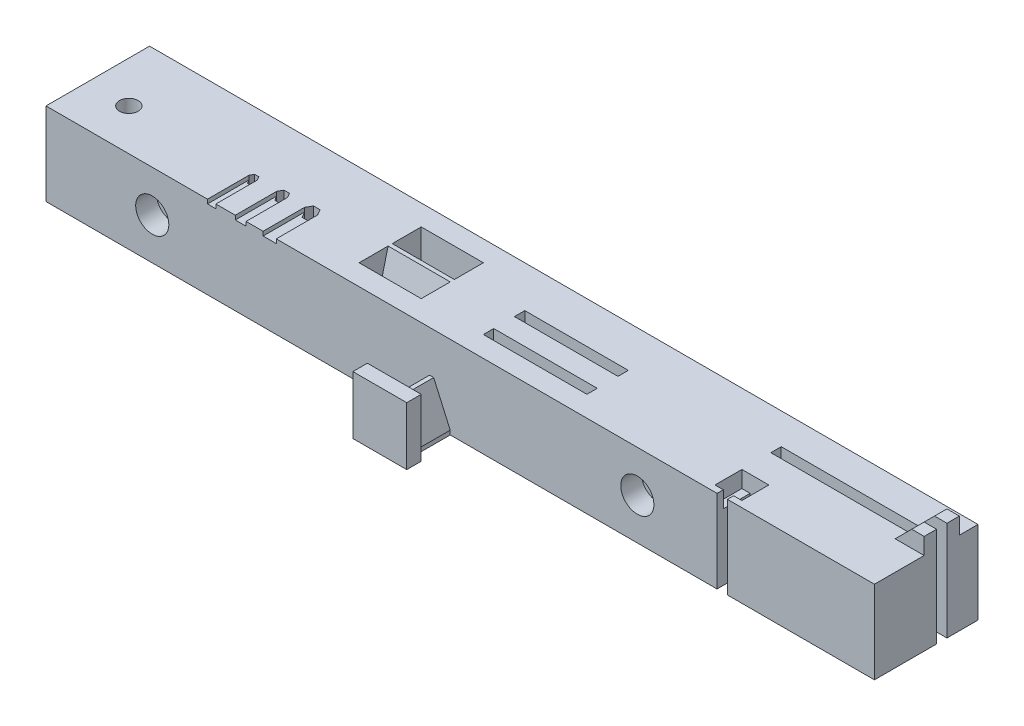
from build123d import *

# Parameters (mm, degrees)
SCHIZZO1_W                    = 200
SCHIZZO1_H                    = 20
ESTRUSIONE_ESTRUSIONE1_DEPTH  = 25
SCHIZZO2_R                    = 2.25
TAGLIO_ESTRUSIONE1_DEPTH      = 141.400046302
SCHIZZO4_W                    = 2.020725942
SCHIZZO4_H                    = 10
SCHIZZO4_W_2                  = 2.598076211
SCHIZZO4_W_3                  = 3.175426481
TAGLIO_ESTRUSIONE2_DEPTH      = 1
SCHIZZO7_W                    = 15
SCHIZZO7_H                    = 5.5
TAGLIO_ESTRUSIONE3_DEPTH      = 141.400046302
SMUSSO1_SIZE                  = 1.5
SMUSSO1_SIZE2                 = 6
SCHIZZO8_W                    = 25
SCHIZZO8_H                    = 2.5
TAGLIO_ESTRUSIONE4_DEPTH      = 13
SCHIZZO9_W                    = 40
SCHIZZO9_H                    = 2.5
TAGLIO_ESTRUSIONE5_DEPTH      = 141.400046302
SCHIZZO10_W                   = 7
SCHIZZO10_H                   = 3
ESTRUSIONE_ESTRUSIONE5_DEPTH  = 4
SMUSSO2_SIZE                  = 4
SCHIZZO11_W                   = 2.5
SCHIZZO11_H                   = 8
TAGLIO_ESTRUSIONE6_DEPTH      = 141.400046302
SCHIZZO12_W                   = 6.5
SCHIZZO12_H                   = 6.5
TAGLIO_ESTRUSIONE7_DEPTH      = 4
SCHIZZO13_W                   = 9
SCHIZZO13_H                   = 10
ESTRUSIONE_ESTRUSIONE9_DEPTH  = 9
SCHIZZO14_W                   = 13
SCHIZZO14_H                   = 14
ESTRUSIONE_ESTRUSIONE10_DEPTH = 3.5
SMUSSO3_SIZE                  = 9
SMUSSO3_SIZE2                 = 4
SMUSSO4_SIZE                  = 4
SMUSSO4_SIZE2                 = 9
SCHIZZO16_R                   = 2.25
TAGLIO_ESTRUSIONE8_DEPTH      = 141.17038757
SCHIZZO17_R                   = 4
TAGLIO_ESTRUSIONE9_DEPTH      = 5


with BuildPart() as part:
    # Schizzo1 → Estrusione-Estrusione1 (new body)
    with BuildSketch(Plane.XY):
        with Locations((36.701035116, 4.318421053)):
            Rectangle(SCHIZZO1_W, SCHIZZO1_H)
    extrude(amount=ESTRUSIONE_ESTRUSIONE1_DEPTH)

    # Schizzo2 → Taglio-Estrusione1 (cut, through all)
    with BuildSketch(Plane(origin=(0, 14.318421053, 0), x_dir=(1, 0, 0), z_dir=(0, 1, 0))):
        with Locations(Location((-53.298964884, -15, 0), (0, 0, 270))):
            Circle(SCHIZZO2_R)
        Polygon((-23.80414637, -15.875), (-22.793783399, -15.875), (-22.288601913, -15), (-22.793783399, -14.125), (-23.80414637, -14.125), (-24.309327855, -15), align=None)
        Polygon((-14.999926779, -15), (-15.649445831, -13.875), (-16.948483937, -13.875), (-17.59800299, -15), (-16.948483937, -16.125), (-15.649445831, -16.125), align=None)
        Polygon((-8.505108264, -16.375), (-7.711251644, -15), (-8.505108264, -13.625), (-10.092821504, -13.625), (-10.886678125, -15), (-10.092821504, -16.375), align=None)
    extrude(amount=-TAGLIO_ESTRUSIONE1_DEPTH, mode=Mode.SUBTRACT)

    # Schizzo4 → Taglio-Estrusione2 (cut)
    with BuildSketch(Plane(origin=(0, 14.318421053, 0), x_dir=(1, 0, 0), z_dir=(0, 1, 0))):
        with Locations((-23.298964884, -20)):
            Rectangle(SCHIZZO4_W, SCHIZZO4_H)
        with Locations((-16.298964885, -20)):
            Rectangle(SCHIZZO4_W_2, SCHIZZO4_H)
        with Locations((-9.298964885, -20)):
            Rectangle(SCHIZZO4_W_3, SCHIZZO4_H)
    extrude(amount=-TAGLIO_ESTRUSIONE2_DEPTH, mode=Mode.SUBTRACT)

    # Schizzo7 → Taglio-Estrusione3 (cut, through all)
    with BuildSketch(Plane(origin=(0, 14.318421053, 0), x_dir=(1, 0, 0), z_dir=(0, 1, 0))):
        with Locations((14.788748356, -17.25)):
            Rectangle(SCHIZZO7_W, SCHIZZO7_H)
        with Locations((14.788748356, -7.75)):
            Rectangle(SCHIZZO7_W, SCHIZZO7_H)
    extrude(amount=-TAGLIO_ESTRUSIONE3_DEPTH, mode=Mode.SUBTRACT)

    # Smusso1
    smusso1_edges = [part.edges().sort_by_distance(p)[0] for p in [
        (14.788748356, 14.318421053, 14.5),
        (14.788748356, 14.318421053, 10.5),
    ]]
    smusso1_side = [part.faces().sort_by_distance(p)[0] for p in [
        (38.695689024, 14.318421053, 12.36530447),
    ]]
    chamfer(smusso1_edges, length=SMUSSO1_SIZE, length2=SMUSSO1_SIZE2, reference=smusso1_side[0])

    # Schizzo8 → Taglio-Estrusione4 (cut)
    with BuildSketch(Plane(origin=(0, 14.318421053, 0), x_dir=(1, 0, 0), z_dir=(0, 1, 0))):
        with Locations((49.788748356, -18.75)):
            Rectangle(SCHIZZO8_W, SCHIZZO8_H)
        with Locations((49.788748356, -11.25)):
            Rectangle(SCHIZZO8_W, SCHIZZO8_H)
    extrude(amount=-TAGLIO_ESTRUSIONE4_DEPTH, mode=Mode.SUBTRACT)

    # Schizzo9 → Taglio-Estrusione5 (cut, through all)
    with BuildSketch(Plane(origin=(0, 14.318421053, 0), x_dir=(1, 0, 0), z_dir=(0, 1, 0))):
        with Locations((116.701035116, -8.75)):
            Rectangle(SCHIZZO9_W, SCHIZZO9_H)
    extrude(amount=-TAGLIO_ESTRUSIONE5_DEPTH, mode=Mode.SUBTRACT)

    # Schizzo10 → Estrusione-Estrusione5 (add)
    with BuildSketch(Plane(origin=(0, 14.318421053, 0), x_dir=(1, 0, 0), z_dir=(0, 1, 0))):
        with Locations((133.201035116, -6)):
            Rectangle(SCHIZZO10_W, SCHIZZO10_H)
        with Locations((133.201035116, -11.5)):
            Rectangle(SCHIZZO10_W, SCHIZZO10_H)
    extrude(amount=ESTRUSIONE_ESTRUSIONE5_DEPTH)

    # Smusso2
    smusso2_edges = [part.edges().sort_by_distance(p)[0] for p in [
        (129.701035116, 18.318421053, 11.5),
        (129.701035116, 18.318421053, 6),
    ]]
    chamfer(smusso2_edges, length=SMUSSO2_SIZE - 0.0001)  # a hair under: the kernel refuses the full size

    # Schizzo11 → Taglio-Estrusione6 (cut, through all)
    with BuildSketch(Plane(origin=(0, 14.318421053, 0), x_dir=(1, 0, 0), z_dir=(0, 1, 0))):
        with Locations((99.951035116, -21)):
            Rectangle(SCHIZZO11_W, SCHIZZO11_H)
    extrude(amount=-TAGLIO_ESTRUSIONE6_DEPTH, mode=Mode.SUBTRACT)

    # Schizzo12 → Taglio-Estrusione7 (cut)
    with BuildSketch(Plane(origin=(0, 14.318421053, 0), x_dir=(1, 0, 0), z_dir=(0, 1, 0))):
        with Locations((99.951035116, -20.25)):
            Rectangle(SCHIZZO12_W, SCHIZZO12_H)
    extrude(amount=-TAGLIO_ESTRUSIONE7_DEPTH, mode=Mode.SUBTRACT)

    # Schizzo13 → Estrusione-Estrusione9 (add)
    with BuildSketch(Plane.XY.offset(25)):
        with Locations((29.788748356, -0.681578947)):
            Rectangle(SCHIZZO13_W, SCHIZZO13_H)
    extrude(amount=ESTRUSIONE_ESTRUSIONE9_DEPTH)

    # Schizzo14 → Estrusione-Estrusione10 (add)
    with BuildSketch(Plane.XY.offset(34)):
        with Locations((29.788748356, 1.318421053)):
            Rectangle(SCHIZZO14_W, SCHIZZO14_H)
    extrude(amount=ESTRUSIONE_ESTRUSIONE10_DEPTH)

    # Smusso3
    smusso3_edges = [part.edges().sort_by_distance(p)[0] for p in [
        (34.288748356, 4.318421053, 29.5),
    ]]
    smusso3_side = [part.faces().sort_by_distance(p)[0] for p in [
        (34.288748356, -0.681578947, 29.5),
    ]]
    chamfer(smusso3_edges, length=SMUSSO3_SIZE, length2=SMUSSO3_SIZE2, reference=smusso3_side[0])

    # Smusso4
    smusso4_edges = [part.edges().sort_by_distance(p)[0] for p in [
        (25.288748356, 4.318421053, 29.5),
    ]]
    smusso4_side = [part.faces().sort_by_distance(p)[0] for p in [
        (27.788748356, 4.318421053, 29.5),
    ]]
    chamfer(smusso4_edges, length=SMUSSO4_SIZE, length2=SMUSSO4_SIZE2, reference=smusso4_side[0])

    # Schizzo16 → Taglio-Estrusione8 (cut, through all)
    with BuildSketch(Plane.XY.offset(25)):
        with Locations((-37.648964884, 4.318421053)):
            Circle(SCHIZZO16_R)
        with Locations((79.451035116, 4.318421053)):
            Circle(SCHIZZO16_R)
    extrude(amount=-TAGLIO_ESTRUSIONE8_DEPTH, mode=Mode.SUBTRACT)

    # Schizzo17 → Taglio-Estrusione9 (cut)
    with BuildSketch(Plane.XY.offset(25)):
        with Locations((-37.648964884, 4.318421053)):
            Circle(SCHIZZO17_R)
        with Locations((79.451035116, 4.318421053)):
            Circle(SCHIZZO17_R)
    extrude(amount=-TAGLIO_ESTRUSIONE9_DEPTH, mode=Mode.SUBTRACT)


solid = part.part
